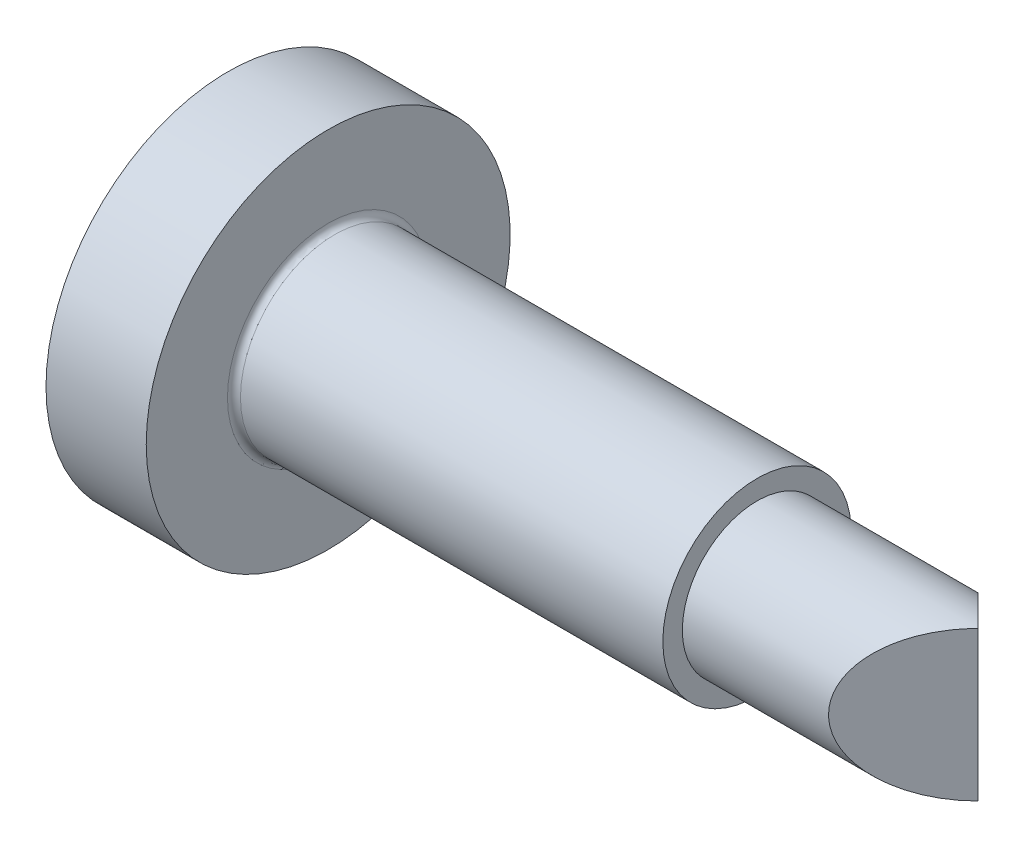
from build123d import *

# Parameters (mm, degrees)
FILLET1_R               = 0.1
CUT_EXTRUDE1_DEPTH      = 14.016912076
CUT_EXTRUDE1_DEPTH_BACK = 14.016912076
CROSSRECESS_DEPTH       = 0.8
FILLET2_R               = 0.3
DRAFT1_ANGLE            = -25
CUT_EXTRUDE3_DEPTH      = 0.8


with BuildPart() as part:
    # Sketch1 → Base (revolve)
    with BuildSketch(Plane.XY):
        with BuildLine():
            Line((2.4, 1.45), (9, 1.45))
            Line((9, 1.45), (9, 1.15))
            Line((9, 1.15), (12.4, 1.15))
            Line((12.4, 1.15), (12.4, 0))
            Line((12.4, 0), (0, 0))
            ThreePointArc((0, 0), (0.219188606, 1.464186604), (0.857536965, 2.8))
            Line((0.857536965, 2.8), (2.4, 2.8))
            Line((2.4, 2.8), (2.4, 1.45))
        make_face()
    revolve(axis=Axis((-43.159349593, 0, 0), (1, 0, 0)))

    # Fillet1
    fillet1_edges = [part.edges().sort_by_distance(p)[0] for p in [
        (2.4, -1.45, 0),
    ]]
    fillet(fillet1_edges, radius=FILLET1_R)

    # Sketch2 → Cut-Extrude1 (cut, two sides: drawn at the far end of the back side and taken through both)
    with BuildSketch(Plane(origin=(0, 0, 0), x_dir=(1, 0, 0), z_dir=(0, 1, 0)).offset(-CUT_EXTRUDE1_DEPTH_BACK)):
        Polygon((12.4, 0), (11.25, 1.15), (11.25, 1.874585807), (12.75845128, 1.874585807), (12.75845128, -1.874585807), (11.25, -1.874585807), (11.25, -1.15), align=None)
    extrude(amount=CUT_EXTRUDE1_DEPTH + CUT_EXTRUDE1_DEPTH_BACK, mode=Mode.SUBTRACT)

    # Sketch3 → CrossRecess (cut)
    with BuildSketch(Plane(origin=(0, 0, 0), x_dir=(0, 0, -1), z_dir=(1, 0, 0))):
        Polygon((-0.3, 0.3), (-1.5, 0.3), (-1.5, -0.3), (-0.3, -0.3), (-0.3, -1.5), (0.3, -1.5), (0.3, -0.3), (1.5, -0.3), (1.5, 0.3), (0.3, 0.3), (0.3, 1.5), (-0.3, 1.5), align=None)
    extrude(amount=CROSSRECESS_DEPTH, mode=Mode.SUBTRACT)

    # Fillet2
    fillet2_edges = [part.edges().sort_by_distance(p)[0] for p in [
        (0.409016259, 0.3, 0.3),
        (0.409016259, 0.3, -0.3),
        (0.409016259, -0.3, 0.3),
        (0.409016259, -0.3, -0.3),
    ]]
    fillet(fillet2_edges, radius=FILLET2_R)

    # Draft1
    draft1_faces = [part.faces().sort_by_distance(p)[0] for p in [
        (0.516718364, -1.5, 0),
        (0.516718364, 0, -1.5),
        (0.516718364, 0, 1.5),
        (0.516718364, 1.5, 0),
    ]]
    draft(draft1_faces, Plane(origin=(0, 0, 0), x_dir=(0, 0, 1), z_dir=(1, 0, 0)), DRAFT1_ANGLE)

    # Sketch4 → Cut-Extrude3 (cut)
    with BuildSketch(Plane(origin=(0, 0, 0), x_dir=(0, 0, -1), z_dir=(1, 0, 0))):
        Polygon((0, 0.448287736), (1.060660172, 1.060660172), (0.448287736, 0), (1.060660172, -1.060660172), (0, -0.448287736), (-1.060660172, -1.060660172), (-0.448287736, 0), (-1.060660172, 1.060660172), align=None)
    extrude(amount=CUT_EXTRUDE3_DEPTH, mode=Mode.SUBTRACT)


solid = part.part
